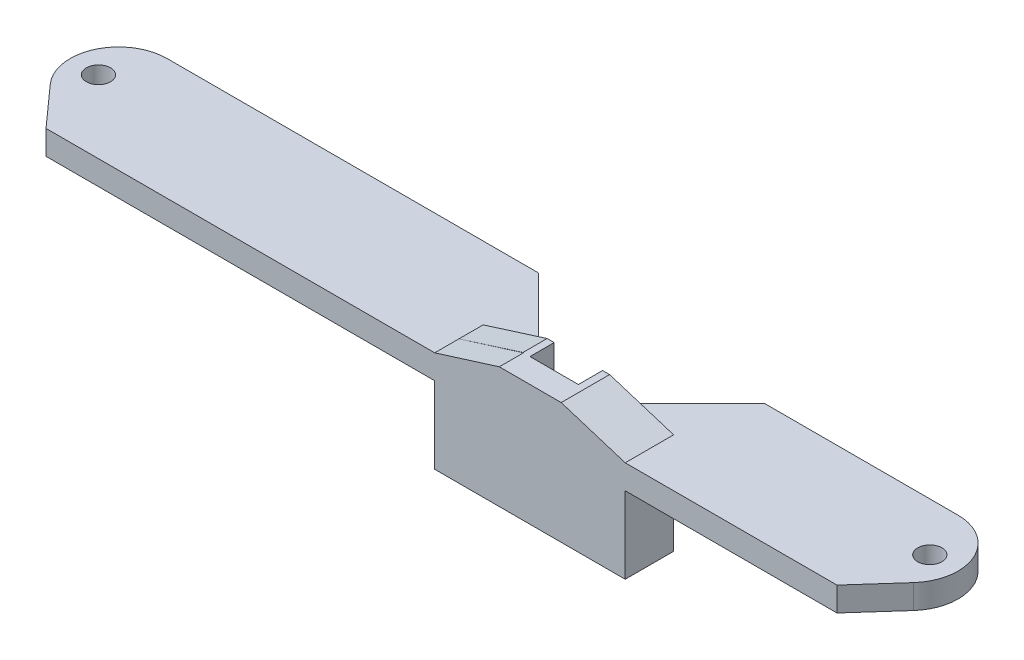
from build123d import *
from OCP.BRepFilletAPI import BRepFilletAPI_MakeChamfer

# Parameters (mm, degrees)
SKETCH1_R           = 1.5
BOSS_EXTRUDE1_DEPTH = 3
CUT_EXTRUDE1_DEPTH  = 10
CUT_EXTRUDE3_START  = -3
SKETCH8_W           = 6
SKETCH8_H           = 3
CUT_EXTRUDE3_DEPTH  = 4
BOSS_EXTRUDE4_START = 2.5
BOSS_EXTRUDE4_DEPTH = 15
BOSS_EXTRUDE5_DEPTH = 3
BOSS_EXTRUDE6_START = 2.5
SKETCH11_W          = 8
SKETCH11_H          = 3
BOSS_EXTRUDE6_DEPTH = 15
CHAMFER1_SIZE       = 7.928987006
CHAMFER1_SIZE_2     = 2.5
SKETCH12_W          = 6
SKETCH12_H          = 0.5
BOSS_EXTRUDE7_DEPTH = 3
BOSS_EXTRUDE8_START = 6
BOSS_EXTRUDE8_DEPTH = 3
BOSS_EXTRUDE9_DEPTH = 3


with BuildPart() as part:
    # Sketch1 → Boss-Extrude1 (new body)
    with BuildSketch(Plane(origin=(0, 0, 0), x_dir=(1, 0, 0), z_dir=(0, 1, 0))):
        with BuildLine():
            Line((-49, 6), (49, 6))
            ThreePointArc((49, 6), (55, 0), (49, -6))
            Line((49, -6), (-49, -6))
            ThreePointArc((-49, -6), (-55, 0), (-49, 6))
        make_face()
        with Locations(Location((-51.5, 0, 0), (0, 0, 270))):
            Circle(SKETCH1_R, mode=Mode.SUBTRACT)
        with Locations(Location((51.5, 0, 0), (0, 0, 270))):
            Circle(SKETCH1_R, mode=Mode.SUBTRACT)
    extrude(amount=BOSS_EXTRUDE1_DEPTH)

    # Sketch2 → Cut-Extrude1 (cut)
    with BuildSketch(Plane(origin=(0, 3, 0), x_dir=(1, 0, 0), z_dir=(0, 1, 0))):
        Polygon((-9, 6), (0, -3), (22, -3), (31, 6), align=None)
    extrude(amount=-CUT_EXTRUDE1_DEPTH, mode=Mode.SUBTRACT)

    # Sketch8 → Cut-Extrude3 (cut)
    with BuildSketch(Plane.XY.offset(6).offset(CUT_EXTRUDE3_START)):
        with Locations((10.960071178, 1.5)):
            Rectangle(SKETCH8_W, SKETCH8_H)
    extrude(amount=CUT_EXTRUDE3_DEPTH, mode=Mode.SUBTRACT)


with BuildPart() as cut_extrude3_piece_1:
    # of the separate pieces the step leaves, piece 1, a body of its own (cut_extrude3_pieces)
    add(part.part.solids().sort_by_distance((-49, 0, -6))[0])

    # Sketch9 → Boss-Extrude4 (add)
    with BuildSketch(Plane(origin=(0, 3, 0), x_dir=(1, 0, 0), z_dir=(0, 1, 0)).offset(BOSS_EXTRUDE4_START)):
        Polygon((13.960071178, -6), (13.960071178, -3), (14.760071178, -3), (14.760071178, -6.8), (7.160071178, -6.8), (7.160071178, -3), (7.960071178, -3), (7.960071178, -6), align=None)
    extrude(amount=-BOSS_EXTRUDE4_DEPTH)



with BuildPart() as cut_extrude3_piece_2:
    # of the separate pieces the step leaves, piece 2, a body of its own (cut_extrude3_pieces)
    add(part.part.solids().sort_by_distance((49, 0, 6))[0])


with BuildPart() as cut_extrude3_piece_1_1:
    add(cut_extrude3_piece_1.part)

    add(cut_extrude3_piece_2.part)  # Boss-Extrude5 merges Cut-Extrude3 piece 2
    # Sketch10 → Boss-Extrude5 (add)
    with BuildSketch(Plane(origin=(0, 0, 0), x_dir=(1, 0, 0), z_dir=(0, 1, 0))):
        Polygon((22, -3), (16, -3), (25, 6), (31, 6), align=None)
        Polygon((0, -3), (6, -3), (-3, 6), (-9, 6), align=None)
    extrude(amount=BOSS_EXTRUDE5_DEPTH)

    # Sketch11 → Boss-Extrude6 (add)
    with BuildSketch(Plane(origin=(0, 3, 0), x_dir=(1, 0, 0), z_dir=(0, 1, 0)).offset(BOSS_EXTRUDE6_START)):
        with Locations((3.160071178, -4.5)):
            Rectangle(SKETCH11_W, SKETCH11_H)
        Polygon((16, -3), (14.760071178, -3), (14.760071178, -6), (22.760071178, -6), (22.760071178, -3), align=None)
    extrude(amount=-BOSS_EXTRUDE6_DEPTH)

    # Chamfer1
    chamfer1_edges_1 = [cut_extrude3_piece_1_1.edges().sort_by_distance(p)[0] for p in [
        (-0.839928822, 5.5, 4.5),
    ]]
    chamfer1_side_1 = [cut_extrude3_piece_1_1.faces().sort_by_distance(p)[0] for p in [
        (-0.789928822, 5.5, 4.5),
    ]]
    chamfer1_edges_2 = [cut_extrude3_piece_1_1.edges().sort_by_distance(p)[0] for p in [
        (22.760071178, 5.5, 4.5),
    ]]
    chamfer1_side_2 = [cut_extrude3_piece_1_1.faces().sort_by_distance(p)[0] for p in [
        (22.760071178, 5.45, 4.5),
    ]]
    chamfer1 = BRepFilletAPI_MakeChamfer(cut_extrude3_piece_1_1.part.solid().wrapped)
    for e in chamfer1_edges_1:
        chamfer1.Add(CHAMFER1_SIZE - 0.0001, CHAMFER1_SIZE_2 - 0.0001, e.wrapped, chamfer1_side_1[0].wrapped)
    for e in chamfer1_edges_2:
        chamfer1.Add(CHAMFER1_SIZE_2 - 0.0001, CHAMFER1_SIZE - 0.0001, e.wrapped, chamfer1_side_2[0].wrapped)
    add(Compound.cast(chamfer1.Shape()), mode=Mode.REPLACE)  # a hair under: the kernel refuses the full size

    # Sketch12 → Boss-Extrude7 (add)
    with BuildSketch(Plane(origin=(0, 0, 6), x_dir=(-1, 0, 0), z_dir=(0, 0, -1))):
        with Locations((-10.960071178, -9.25)):
            Rectangle(SKETCH12_W, SKETCH12_H)
    extrude(amount=BOSS_EXTRUDE7_DEPTH)

    # Sketch13 → Boss-Extrude8 (add)
    with BuildSketch(Plane.XY.offset(BOSS_EXTRUDE8_START)):
        Polygon((7.160071178, 5.5), (-0.839928822, 3), (-49, 3), (-49, 0), (-0.839928822, 0), (-0.839928822, -9.5), (7.160071178, -9.5), (14.760071178, -9.5), (22.760071178, -9.5), (22.760071178, 0), (49, 0), (49, 3), (22.760071178, 3), (14.831084172, 5.5), (14.760071178, 5.5), align=None)
    extrude(amount=BOSS_EXTRUDE8_DEPTH)

    # Sketch14 → Boss-Extrude9 (add)
    with BuildSketch(Plane(origin=(0, 3, 0), x_dir=(1, 0, 0), z_dir=(0, 1, 0))):
        with BuildLine():
            Line((-49, -9), (-53.472135955, -4))
            ThreePointArc((-53.472135955, -4), (-51.449489743, -5.477225575), (-49, -6))
            Line((-49, -6), (-49, -9))
        make_face()
        with BuildLine():
            Line((49, -9), (53.472135955, -4))
            ThreePointArc((53.472135955, -4), (51.449489743, -5.477225575), (49, -6))
            Line((49, -6), (49, -9))
        make_face()
    extrude(amount=-BOSS_EXTRUDE9_DEPTH)


solid = cut_extrude3_piece_1_1.part
